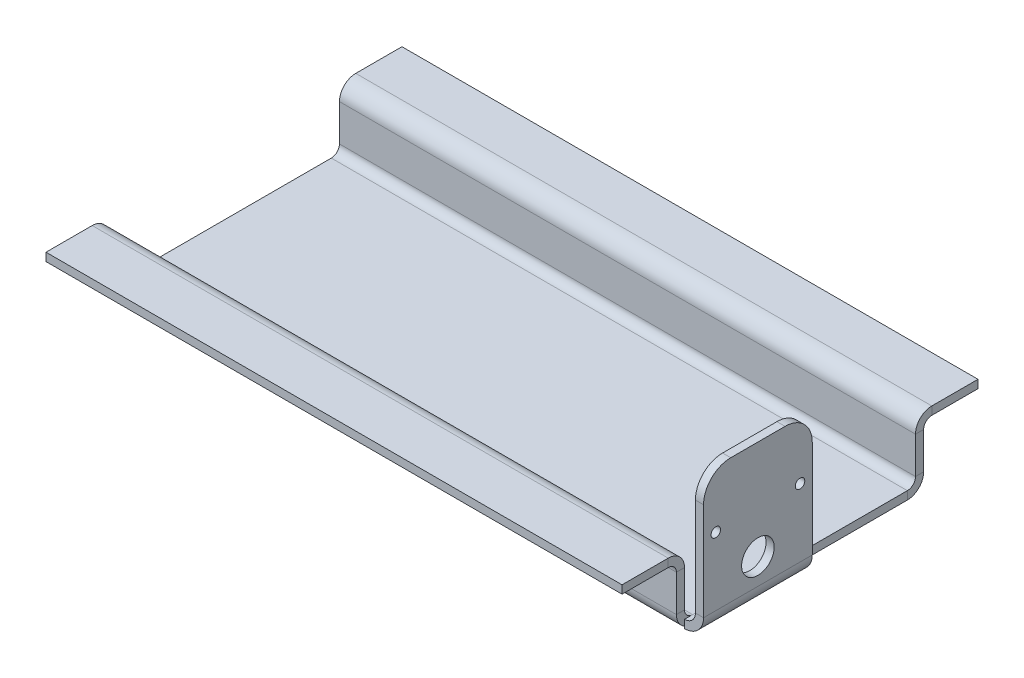
from build123d import *

# Parameters (mm, degrees)
BASE_FLANGE1_DEPTH            = 3
EDGE_FLANGE1_STRIP_W          = 20
EDGE_FLANGE1_STRIP_H          = 3
EDGE_FLANGE1_STRIP_CUT_DEPTH  = 40
EDGE_FLANGE1_RELIEF_W         = 21.5
EDGE_FLANGE1_RELIEF_H         = 1.5
EDGE_FLANGE1_RELIEF_CUT_DEPTH = 3
EDGE_FLANGE1_DEPTH            = 40
SKETCH10_R                    = 1.75
SKETCH10_R_2                  = 6
CUT_EXTRUDE1_DEPTH            = 226.814636372
EDGE_FLANGE2_STRIP_W          = 18
EDGE_FLANGE2_STRIP_H          = 3
EDGE_FLANGE2_STRIP_CUT_DEPTH  = 212
EDGE_FLANGE2_DEPTH            = 212
EDGE_FLANGE3_STRIP_W          = 18
EDGE_FLANGE3_STRIP_H          = 3
EDGE_FLANGE3_STRIP_CUT_DEPTH  = 212
EDGE_FLANGE3_DEPTH            = 212
MIRROR1_START                 = -107.5
MIRROR1_DEPTH                 = 213.5
MIRROR1_START_2               = 104.5
MIRROR1_2_DEPTH               = 1.5
MIRROR1_3_DEPTH               = 212
TAB1_DEPTH                    = 3
CUT_EXTRUDE2_DEPTH            = 10


# Read off the part's stored shape, not the designer's step: Mirror1
# Sheet-metal steps are written as plain solids
with BuildPart() as part:
    # Sketch1 → Base-Flange1 (new body)
    with BuildSketch(Plane(origin=(0, 0, 0), x_dir=(1, 0, 0), z_dir=(0, 1, 0))):
        Polygon((-107.5, -42.5), (108.5, -42.5), (108.5, -2.5), (107.5, -2.5), (107.5, 42.5), (-107.5, 42.5), align=None)
    extrude(amount=-BASE_FLANGE1_DEPTH)

    # Edge-Flange1 strip (across the edge) → Edge-Flange1 strip cut (cut)
    with BuildSketch(Plane(origin=(108.5, 0, 42.5), x_dir=(-1, 0, 0), z_dir=(0, 0, -1))):
        with Locations((-6, -1.5)):
            Rectangle(EDGE_FLANGE1_STRIP_W, EDGE_FLANGE1_STRIP_H)
    extrude(amount=EDGE_FLANGE1_STRIP_CUT_DEPTH, mode=Mode.SUBTRACT)

    # Edge-Flange1 relief (on the sheet) → Edge-Flange1 relief cut (cut)
    with BuildSketch(Plane(origin=(104.5, 0, 42.5), x_dir=(-1, 0, 0), z_dir=(0, 1, 0))):
        with Locations((-9.25, -40.75)):
            Rectangle(EDGE_FLANGE1_RELIEF_W, EDGE_FLANGE1_RELIEF_H)
    extrude(amount=-EDGE_FLANGE1_RELIEF_CUT_DEPTH, mode=Mode.SUBTRACT)

    # Edge-Flange1 section (across the edge) → Edge-Flange1 (add)
    with BuildSketch(Plane(origin=(108.5, 0, 42.5), x_dir=(-1, 0, 0), z_dir=(0, 0, -1))):
        with BuildLine():
            Line((-3, 4), (-3, 35))
            Line((-3, 35), (0, 35))
            Line((0, 35), (0, 4))
            ThreePointArc((0, 4), (1.171572875, 1.171572875), (4, 0))
            Line((4, 0), (4, -3))
            ThreePointArc((4, -3), (-0.949747468, -0.949747468), (-3, 4))
        make_face()
    extrude(amount=EDGE_FLANGE1_DEPTH)

    # Sketch10 → Cut-Extrude1 (cut, through all)
    with BuildSketch(Plane(origin=(111.5, 0, 0), x_dir=(0, 0, -1), z_dir=(1, 0, 0))):
        with Locations(Location((-38, 29, 0), (0, 0, 90))):
            Circle(SKETCH10_R)
        with Locations(Location((-7, 29, 0), (0, 0, 90))):
            Circle(SKETCH10_R)
        with Locations(Location((-22.5, 13.5, 0), (0, 0, 90))):
            Circle(SKETCH10_R_2)
    extrude(amount=-CUT_EXTRUDE1_DEPTH, mode=Mode.SUBTRACT)

    # Edge-Flange2 strip (across the edge) → Edge-Flange2 strip cut (cut)
    with BuildSketch(Plane(origin=(-107.5, 0, 42.5), x_dir=(0, 0, -1), z_dir=(1, 0, 0))):
        with Locations((-6, -1.5)):
            Rectangle(EDGE_FLANGE2_STRIP_W, EDGE_FLANGE2_STRIP_H)
    extrude(amount=EDGE_FLANGE2_STRIP_CUT_DEPTH, mode=Mode.SUBTRACT)

    # Edge-Flange2 section (across the edge) → Edge-Flange2 (add)
    with BuildSketch(Plane(origin=(-107.5, 0, 42.5), x_dir=(0, 0, -1), z_dir=(1, 0, 0))):
        with BuildLine():
            Line((-3, 3), (-3, 19.5))
            Line((-3, 19.5), (0, 19.5))
            Line((0, 19.5), (0, 3))
            ThreePointArc((0, 3), (0.878679656, 0.878679656), (3, 0))
            Line((3, 0), (3, -3))
            ThreePointArc((3, -3), (-1.242640687, -1.242640687), (-3, 3))
        make_face()
    extrude(amount=EDGE_FLANGE2_DEPTH)

    # Edge-Flange3 strip (across the edge) → Edge-Flange3 strip cut (cut)
    with BuildSketch(Plane(origin=(104.5, 19.5, 45.5), x_dir=(0, -1, 0), z_dir=(-1, 0, 0))):
        with Locations((-6, -1.5)):
            Rectangle(EDGE_FLANGE3_STRIP_W, EDGE_FLANGE3_STRIP_H)
    extrude(amount=EDGE_FLANGE3_STRIP_CUT_DEPTH, mode=Mode.SUBTRACT)

    # Edge-Flange3 section (across the edge) → Edge-Flange3 (add)
    with BuildSketch(Plane(origin=(104.5, 19.5, 45.5), x_dir=(0, -1, 0), z_dir=(-1, 0, 0))):
        with BuildLine():
            Line((-3, 3), (-3, 20))
            Line((-3, 20), (0, 20))
            Line((0, 20), (0, 3))
            ThreePointArc((0, 3), (0.878679656, 0.878679656), (3, 0))
            Line((3, 0), (3, -3))
            ThreePointArc((3, -3), (-1.242640687, -1.242640687), (-3, 3))
        make_face()
    extrude(amount=EDGE_FLANGE3_DEPTH)

    # Mirror1 outline → Mirror1 (cut)
    with BuildSketch(Plane.YZ.offset(MIRROR1_START)):
        with BuildLine():
            Line((-3, -42.5), (-2.196152423, -42.5))
            ThreePointArc((-2.196152423, -42.5), (-2.795554958, -41.052914271), (-3, -39.5))
            Line((-3, -39.5), (-3, -42.5))
        make_face()
    extrude(amount=MIRROR1_DEPTH, mode=Mode.SUBTRACT)

    # Mirror1 2 outline → Mirror1 2 (cut)
    with BuildSketch(Plane.YZ.offset(MIRROR1_START_2)):
        with BuildLine():
            ThreePointArc((-3, -39.5), (-2.795554958, -41.052914271), (-2.196152423, -42.5))
            Line((-2.196152423, -42.5), (0, -42.5))
            Line((0, -42.5), (0, -38))
            Line((0, -38), (-3, -38))
            Line((-3, -38), (-3, -39.5))
        make_face()
    extrude(amount=MIRROR1_2_DEPTH, mode=Mode.SUBTRACT)

    # Mirror1 3 outline → Mirror1 3 (add)
    with BuildSketch(Plane.YZ.offset(MIRROR1_START)):
        with BuildLine():
            Line((3, -45.5), (16.5, -45.5))
            ThreePointArc((16.5, -45.5), (18.621320344, -46.378679656), (19.5, -48.5))
            Line((19.5, -48.5), (19.5, -65.5))
            Line((19.5, -65.5), (22.5, -65.5))
            Line((22.5, -65.5), (22.5, -48.5))
            ThreePointArc((22.5, -48.5), (20.742640687, -44.257359313), (16.5, -42.5))
            Line((16.5, -42.5), (3, -42.5))
            ThreePointArc((3, -42.5), (0.878679656, -41.621320344), (0, -39.5))
            Line((0, -39.5), (0, -42.5))
            Line((0, -42.5), (-2.196152423, -42.5))
            ThreePointArc((-2.196152423, -42.5), (0, -44.696152423), (3, -45.5))
        make_face()
    extrude(amount=MIRROR1_3_DEPTH)

    # Sketch18 → Tab1 (add)
    with BuildSketch(Plane(origin=(111.5, 0, 0), x_dir=(0, 0, -1), z_dir=(1, 0, 0))):
        with BuildLine():
            Line((-42.5, 35), (-2.5, 35))
            Line((-2.5, 35), (-2.5, 40))
            ThreePointArc((-2.5, 40), (-5.428932188, 47.071067812), (-12.5, 50))
            Line((-12.5, 50), (-32.5, 50))
            ThreePointArc((-32.5, 50), (-39.571067812, 47.071067812), (-42.5, 40))
            Line((-42.5, 40), (-42.5, 35))
        make_face()
    extrude(amount=-TAB1_DEPTH)

    # Sketch19 → Cut-Extrude2 (cut)
    with BuildSketch(Plane(origin=(0, 0, 0), x_dir=(1, 0, 0), z_dir=(0, 1, 0))):
        Polygon((107.5, -1), (107.5, 42.5), (106, 42.5), (104.5, 38), (104.5, -1), align=None)
    extrude(amount=-CUT_EXTRUDE2_DEPTH, mode=Mode.SUBTRACT)


solid = part.part
